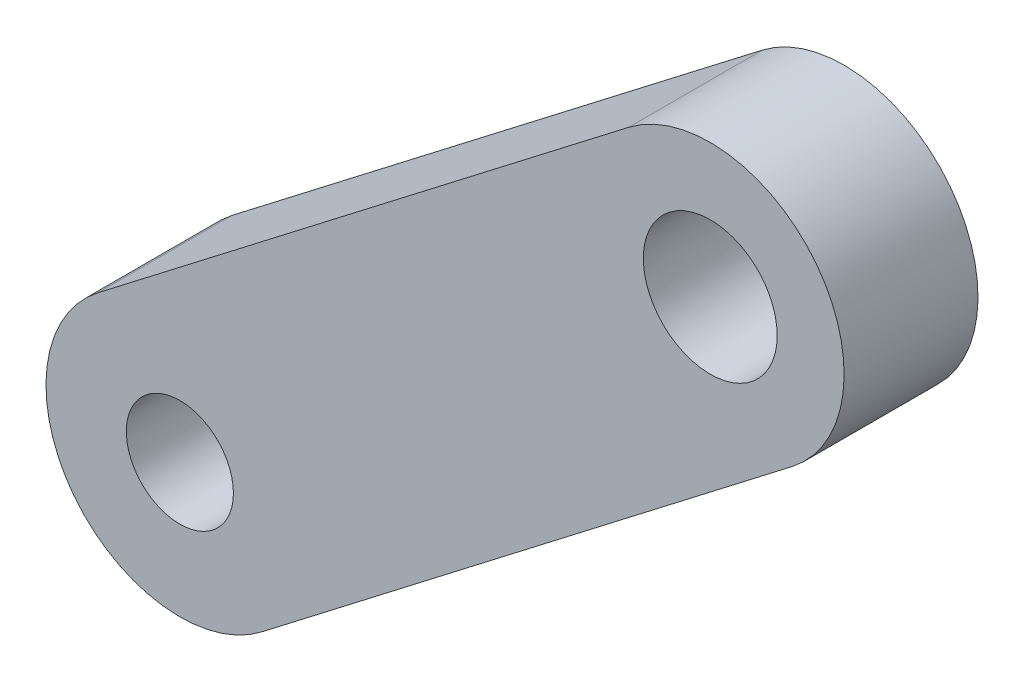
from build123d import *

# Parameters (mm, degrees)
SKETCH1_R           = 2
SKETCH1_R_2         = 2.5
BOSS_EXTRUDE1_DEPTH = 5


with BuildPart() as part:
    # Sketch1 → Boss-Extrude1 (new body)
    with BuildSketch(Plane(origin=(0, 0, 0), x_dir=(0.9997573026985189, -0.022030335925312537, 0), z_dir=(0, 0, 1))):
        with BuildLine():
            Line((-29.904437649, 103.275259833), (-49.372163993, 87.590629426))
            ThreePointArc((-49.372163993, 87.590629426), (-50.12878318, 80.560158076), (-43.09831183, 79.803538889))
            Line((-43.09831183, 79.803538889), (-23.630585486, 95.488169295))
            ThreePointArc((-23.630585486, 95.488169295), (-23.225758684, 95.852410595), (-22.86294507, 96.25851741))
            ThreePointArc((-22.86294507, 96.25851741), (-23.238207598, 102.923467448), (-29.904437649, 103.275259833))
        make_face()
        with Locations((-46.235237911, 83.697084158)):
            Circle(SKETCH1_R, mode=Mode.SUBTRACT)
        with Locations((-26.767511567, 99.381714564)):
            Circle(SKETCH1_R_2, mode=Mode.SUBTRACT)
    extrude(amount=BOSS_EXTRUDE1_DEPTH)


solid = part.part
